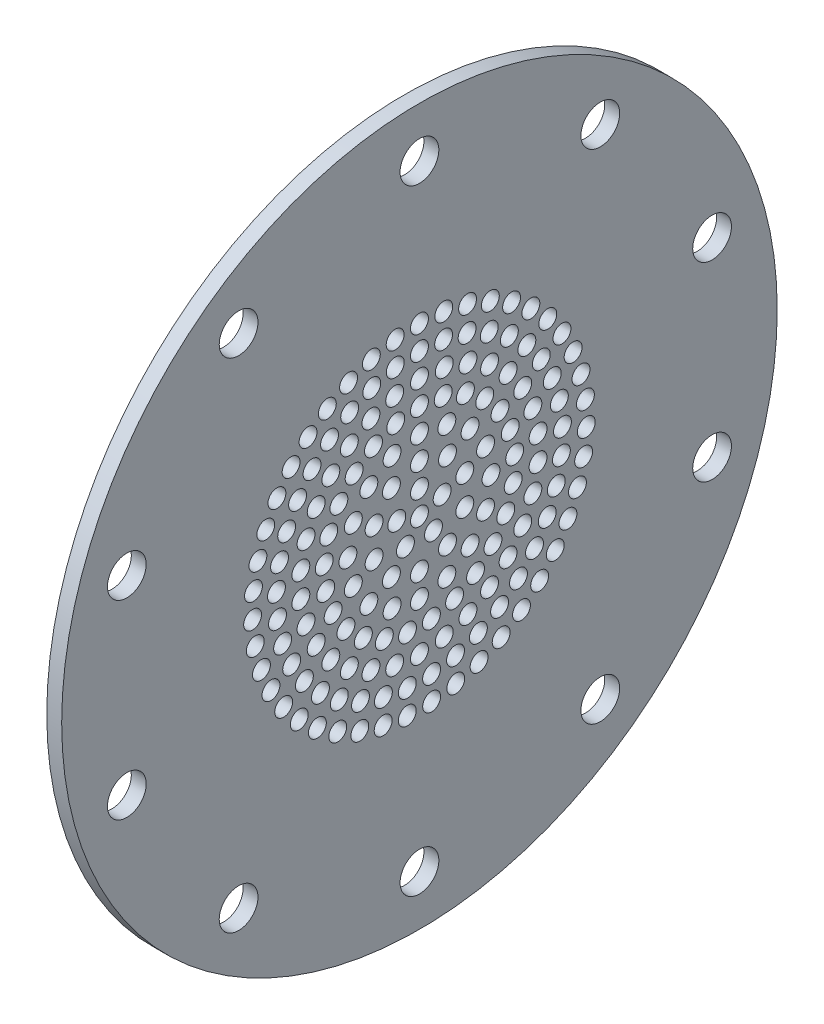
from build123d import *

# Parameters (mm, degrees)
SKETCH3_R          = 1.5
CUT_EXTRUDE6_DEPTH = 10
SKETCH4_R          = 3.25
CUT_EXTRUDE7_DEPTH = 10


with BuildPart() as part:
    # Sketch2 → Revolve1 (revolve)
    with BuildSketch(Plane.XY):
        Polygon((2.5, 0), (2.5, 31), (2.5, 60), (0, 60), (0, 0), align=None)
    revolve(axis=Axis((0, 0, 0), (1, 0, 0)))

    # Sketch3 → Cut-Extrude6 (cut)
    with BuildSketch(Plane.ZY):
        with Locations((4.592201188, 11.08655439)):
            Circle(SKETCH3_R)
        Circle(SKETCH3_R)
        with Locations((0, 4)):
            Circle(SKETCH3_R)
        with Locations((0, 8)):
            Circle(SKETCH3_R)
        with Locations((0, 12)):
            Circle(SKETCH3_R)
        with Locations((0, 16)):
            Circle(SKETCH3_R)
        with Locations((0, 20)):
            Circle(SKETCH3_R)
        with Locations((3.979038195, 15.497330578)):
            Circle(SKETCH3_R)
        with Locations((4.158233816, 19.562952015)):
            Circle(SKETCH3_R)
        with Locations((8.485281374, 8.485281374)):
            Circle(SKETCH3_R)
        with Locations((7.708058786, 14.020906881)):
            Circle(SKETCH3_R)
        with Locations((8.134732862, 18.270909153)):
            Circle(SKETCH3_R)
        with Locations((11.08655439, 4.592201188)):
            Circle(SKETCH3_R)
        with Locations((10.952753695, 11.663498039)):
            Circle(SKETCH3_R)
        with Locations((11.755705046, 16.180339887)):
            Circle(SKETCH3_R)
        with Locations((12, 0)):
            Circle(SKETCH3_R)
        with Locations((13.509246808, 8.57322872)):
            Circle(SKETCH3_R)
        with Locations((14.86289651, 13.382612127)):
            Circle(SKETCH3_R)
        with Locations((11.08655439, -4.592201188)):
            Circle(SKETCH3_R)
        with Locations((15.216904261, 4.94427191)):
            Circle(SKETCH3_R)
        with Locations((17.320508076, 10)):
            Circle(SKETCH3_R)
        with Locations((8.485281374, -8.485281374)):
            Circle(SKETCH3_R)
        with Locations((15.968427655, 1.004648312)):
            Circle(SKETCH3_R)
        with Locations((19.021130326, 6.180339887)):
            Circle(SKETCH3_R)
        with Locations((4.592201188, -11.08655439)):
            Circle(SKETCH3_R)
        with Locations((15.716596012, -2.998101033)):
            Circle(SKETCH3_R)
        with Locations((19.890437907, 2.090569265)):
            Circle(SKETCH3_R)
        with Locations((0, -12)):
            Circle(SKETCH3_R)
        with Locations((14.477232839, -6.812468665)):
            Circle(SKETCH3_R)
        with Locations((19.890437907, -2.090569265)):
            Circle(SKETCH3_R)
        with Locations((-4.592201188, -11.08655439)):
            Circle(SKETCH3_R)
        with Locations((12.328211884, -10.198783836)):
            Circle(SKETCH3_R)
        with Locations((19.021130326, -6.180339887)):
            Circle(SKETCH3_R)
        with Locations((-8.485281374, -8.485281374)):
            Circle(SKETCH3_R)
        with Locations((9.404564037, -12.94427191)):
            Circle(SKETCH3_R)
        with Locations((17.320508076, -10)):
            Circle(SKETCH3_R)
        with Locations((-11.08655439, -4.592201188)):
            Circle(SKETCH3_R)
        with Locations((5.889992843, -14.876423774)):
            Circle(SKETCH3_R)
        with Locations((14.86289651, -13.382612127)):
            Circle(SKETCH3_R)
        with Locations((-12, 0)):
            Circle(SKETCH3_R)
        with Locations((2.005331737, -15.873835221)):
            Circle(SKETCH3_R)
        with Locations((11.755705046, -16.180339887)):
            Circle(SKETCH3_R)
        with Locations((-11.08655439, 4.592201188)):
            Circle(SKETCH3_R)
        with Locations((-2.005331737, -15.873835221)):
            Circle(SKETCH3_R)
        with Locations((8.134732862, -18.270909153)):
            Circle(SKETCH3_R)
        with Locations((-8.485281374, 8.485281374)):
            Circle(SKETCH3_R)
        with Locations((-5.889992843, -14.876423774)):
            Circle(SKETCH3_R)
        with Locations((4.158233816, -19.562952015)):
            Circle(SKETCH3_R)
        with Locations((-4.592201188, 11.08655439)):
            Circle(SKETCH3_R)
        with Locations((-9.404564037, -12.94427191)):
            Circle(SKETCH3_R)
        with Locations((0, -20)):
            Circle(SKETCH3_R)
        with Locations((4.702282018, 6.472135955)):
            Circle(SKETCH3_R)
        with Locations((7.60845213, 2.472135955)):
            Circle(SKETCH3_R)
        with Locations((7.60845213, -2.472135955)):
            Circle(SKETCH3_R)
        with Locations((4.702282018, -6.472135955)):
            Circle(SKETCH3_R)
        with Locations((0, -8)):
            Circle(SKETCH3_R)
        with Locations((-4.702282018, -6.472135955)):
            Circle(SKETCH3_R)
        with Locations((-7.60845213, -2.472135955)):
            Circle(SKETCH3_R)
        with Locations((-7.60845213, 2.472135955)):
            Circle(SKETCH3_R)
        with Locations((-4.702282018, 6.472135955)):
            Circle(SKETCH3_R)
        with Locations((3.804226065, 1.236067978)):
            Circle(SKETCH3_R)
        with Locations((2.351141009, -3.236067977)):
            Circle(SKETCH3_R)
        with Locations((-2.351141009, -3.236067977)):
            Circle(SKETCH3_R)
        with Locations((-3.804226065, 1.236067977)):
            Circle(SKETCH3_R)
        with Locations((-12.328211884, -10.198783836)):
            Circle(SKETCH3_R)
        with Locations((-4.158233816, -19.562952015)):
            Circle(SKETCH3_R)
        with Locations((-14.477232839, -6.812468665)):
            Circle(SKETCH3_R)
        with Locations((-8.134732862, -18.270909153)):
            Circle(SKETCH3_R)
        with Locations((-15.716596012, -2.998101033)):
            Circle(SKETCH3_R)
        with Locations((-11.755705046, -16.180339887)):
            Circle(SKETCH3_R)
        with Locations((-15.968427655, 1.004648312)):
            Circle(SKETCH3_R)
        with Locations((-14.86289651, -13.382612127)):
            Circle(SKETCH3_R)
        with Locations((-15.216904261, 4.94427191)):
            Circle(SKETCH3_R)
        with Locations((-17.320508076, -10)):
            Circle(SKETCH3_R)
        with Locations((-13.509246808, 8.57322872)):
            Circle(SKETCH3_R)
        with Locations((-19.021130326, -6.180339887)):
            Circle(SKETCH3_R)
        with Locations((-10.952753695, 11.663498039)):
            Circle(SKETCH3_R)
        with Locations((-19.890437907, -2.090569265)):
            Circle(SKETCH3_R)
        with Locations((-7.708058786, 14.020906881)):
            Circle(SKETCH3_R)
        with Locations((-19.890437907, 2.090569265)):
            Circle(SKETCH3_R)
        with Locations((-3.979038195, 15.497330578)):
            Circle(SKETCH3_R)
        with Locations((-19.021130326, 6.180339887)):
            Circle(SKETCH3_R)
        with Locations((0, 24)):
            Circle(SKETCH3_R)
        with Locations((0, 28)):
            Circle(SKETCH3_R)
        with Locations((-17.320508076, 10)):
            Circle(SKETCH3_R)
        with Locations((-14.86289651, 13.382612127)):
            Circle(SKETCH3_R)
        with Locations((-11.755705046, 16.180339887)):
            Circle(SKETCH3_R)
        with Locations((-8.134732862, 18.270909153)):
            Circle(SKETCH3_R)
        with Locations((-4.158233816, 19.562952015)):
            Circle(SKETCH3_R)
        with Locations((4.056019688, 23.654781848)):
            Circle(SKETCH3_R)
        with Locations((7.995355074, 22.629058691)):
            Circle(SKETCH3_R)
        with Locations((11.704678652, 20.952338716)):
            Circle(SKETCH3_R)
        with Locations((15.077279935, 18.672858104)):
            Circle(SKETCH3_R)
        with Locations((18.016135326, 15.856193361)):
            Circle(SKETCH3_R)
        with Locations((20.436699306, 12.583374805)):
            Circle(SKETCH3_R)
        with Locations((22.269336655, 8.948555467)):
            Circle(SKETCH3_R)
        with Locations((23.461325735, 5.05630248)):
            Circle(SKETCH3_R)
        with Locations((23.978375189, 1.018588877)):
            Circle(SKETCH3_R)
        with Locations((23.805610446, -3.048427674)):
            Circle(SKETCH3_R)
        with Locations((22.948001634, -7.027746511)):
            Circle(SKETCH3_R)
        with Locations((21.430220596, -10.804889876)):
            Circle(SKETCH3_R)
        with Locations((19.295931129, -14.271196231)):
            Circle(SKETCH3_R)
        with Locations((16.606532855, -17.326946255)):
            Circle(SKETCH3_R)
        with Locations((13.439394867, -19.884231582)):
            Circle(SKETCH3_R)
        with Locations((9.885629958, -21.869483769)):
            Circle(SKETCH3_R)
        with Locations((6.047473473, -23.225590726)):
            Circle(SKETCH3_R)
        with Locations((2.035342187, -23.913539725)):
            Circle(SKETCH3_R)
        with Locations((-2.035342187, -23.913539725)):
            Circle(SKETCH3_R)
        with Locations((-6.047473473, -23.225590726)):
            Circle(SKETCH3_R)
        with Locations((-9.885629958, -21.869483769)):
            Circle(SKETCH3_R)
        with Locations((-13.439394867, -19.884231582)):
            Circle(SKETCH3_R)
        with Locations((-16.606532855, -17.326946255)):
            Circle(SKETCH3_R)
        with Locations((-19.295931129, -14.271196231)):
            Circle(SKETCH3_R)
        with Locations((-21.430220596, -10.804889876)):
            Circle(SKETCH3_R)
        with Locations((-22.948001634, -7.027746511)):
            Circle(SKETCH3_R)
        with Locations((-23.805610446, -3.048427674)):
            Circle(SKETCH3_R)
        with Locations((-23.978375189, 1.018588877)):
            Circle(SKETCH3_R)
        with Locations((-23.461325735, 5.05630248)):
            Circle(SKETCH3_R)
        with Locations((-22.269336655, 8.948555467)):
            Circle(SKETCH3_R)
        with Locations((-20.436699306, 12.583374805)):
            Circle(SKETCH3_R)
        with Locations((-18.016135326, 15.856193361)):
            Circle(SKETCH3_R)
        with Locations((-15.077279935, 18.672858104)):
            Circle(SKETCH3_R)
        with Locations((-11.704678652, 20.952338716)):
            Circle(SKETCH3_R)
        with Locations((-7.995355074, 22.629058691)):
            Circle(SKETCH3_R)
        with Locations((-4.056019688, 23.654781848)):
            Circle(SKETCH3_R)
        with Locations((4.076832697, 27.701614306)):
            Circle(SKETCH3_R)
        with Locations((8.066774782, 26.812816797)):
            Circle(SKETCH3_R)
        with Locations((11.884787569, 25.35255065)):
            Circle(SKETCH3_R)
        with Locations((15.449496742, 23.351938901)):
            Circle(SKETCH3_R)
        with Locations((18.684926714, 20.853621117)):
            Circle(SKETCH3_R)
        with Locations((21.522119914, 17.910844604)):
            Circle(SKETCH3_R)
        with Locations((23.900606493, 14.586329534)):
            Circle(SKETCH3_R)
        with Locations((25.76969314, 10.950932174)):
            Circle(SKETCH3_R)
        with Locations((27.089543518, 7.082134707)):
            Circle(SKETCH3_R)
        with Locations((27.832027307, 3.062393835)):
            Circle(SKETCH3_R)
        with Locations((27.981319754, -1.022616646)):
            Circle(SKETCH3_R)
        with Locations((27.534238951, -5.085831827)):
            Circle(SKETCH3_R)
        with Locations((26.500313648, -9.040651334)):
            Circle(SKETCH3_R)
        with Locations((24.901580169, -12.802785053)):
            Circle(SKETCH3_R)
        with Locations((22.772112741, -16.292049636)):
            Circle(SKETCH3_R)
        with Locations((20.157297265, -19.434077466)):
            Circle(SKETCH3_R)
        with Locations((17.112863995, -22.161901676)):
            Circle(SKETCH3_R)
        with Locations((13.703699739, -24.417383428)):
            Circle(SKETCH3_R)
        with Locations((10.002464914, -26.152451045)):
            Circle(SKETCH3_R)
        with Locations((6.088044916, -27.330124572)):
            Circle(SKETCH3_R)
        with Locations((2.043868811, -27.925303943)):
            Circle(SKETCH3_R)
        with Locations((-2.043868811, -27.925303943)):
            Circle(SKETCH3_R)
        with Locations((-6.088044916, -27.330124572)):
            Circle(SKETCH3_R)
        with Locations((-10.002464914, -26.152451045)):
            Circle(SKETCH3_R)
        with Locations((-13.703699739, -24.417383428)):
            Circle(SKETCH3_R)
        with Locations((-17.112863995, -22.161901676)):
            Circle(SKETCH3_R)
        with Locations((-20.157297265, -19.434077466)):
            Circle(SKETCH3_R)
        with Locations((-22.772112741, -16.292049636)):
            Circle(SKETCH3_R)
        with Locations((-24.901580169, -12.802785053)):
            Circle(SKETCH3_R)
        with Locations((-26.500313648, -9.040651334)):
            Circle(SKETCH3_R)
        with Locations((-27.534238951, -5.085831827)):
            Circle(SKETCH3_R)
        with Locations((-27.981319754, -1.022616646)):
            Circle(SKETCH3_R)
        with Locations((-27.832027307, 3.062393835)):
            Circle(SKETCH3_R)
        with Locations((-27.089543518, 7.082134707)):
            Circle(SKETCH3_R)
        with Locations((-25.76969314, 10.950932174)):
            Circle(SKETCH3_R)
        with Locations((-23.900606493, 14.586329534)):
            Circle(SKETCH3_R)
        with Locations((-21.522119914, 17.910844604)):
            Circle(SKETCH3_R)
        with Locations((-18.684926714, 20.853621117)):
            Circle(SKETCH3_R)
        with Locations((-15.449496742, 23.351938901)):
            Circle(SKETCH3_R)
        with Locations((-11.884787569, 25.35255065)):
            Circle(SKETCH3_R)
        with Locations((-8.066774782, 26.812816797)):
            Circle(SKETCH3_R)
        with Locations((-4.076832697, 27.701614306)):
            Circle(SKETCH3_R)
    extrude(amount=-CUT_EXTRUDE6_DEPTH, mode=Mode.SUBTRACT)

    # Sketch4 → Cut-Extrude7 (cut)
    with BuildSketch(Plane.ZY):
        with Locations((0, 51.6)):
            Circle(SKETCH4_R)
        with Locations((30.329719018, 41.74527691)):
            Circle(SKETCH4_R)
        with Locations((49.074516241, 15.94527691)):
            Circle(SKETCH4_R)
        with Locations((49.074516241, -15.94527691)):
            Circle(SKETCH4_R)
        with Locations((30.329719018, -41.74527691)):
            Circle(SKETCH4_R)
        with Locations((0, -51.6)):
            Circle(SKETCH4_R)
        with Locations((-30.329719018, -41.74527691)):
            Circle(SKETCH4_R)
        with Locations((-49.074516241, -15.94527691)):
            Circle(SKETCH4_R)
        with Locations((-49.074516241, 15.94527691)):
            Circle(SKETCH4_R)
        with Locations((-30.329719018, 41.74527691)):
            Circle(SKETCH4_R)
    extrude(amount=-CUT_EXTRUDE7_DEPTH, mode=Mode.SUBTRACT)


solid = part.part
